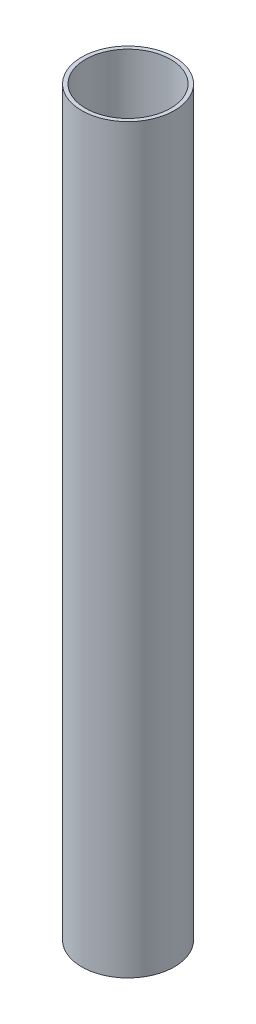
from build123d import *

# Parameters (mm, degrees)
SKETCH1_W = 1.5875
SKETCH1_H = 304.8


with BuildPart() as part:
    # Sketch1 → Revolve2 (revolve)
    with BuildSketch(Plane.XY):
        with Locations((-18.25625, 152.4)):
            Rectangle(SKETCH1_W, SKETCH1_H)
    revolve(axis=Axis((0, 0, 0), (0, 1, 0)))


solid = part.part
